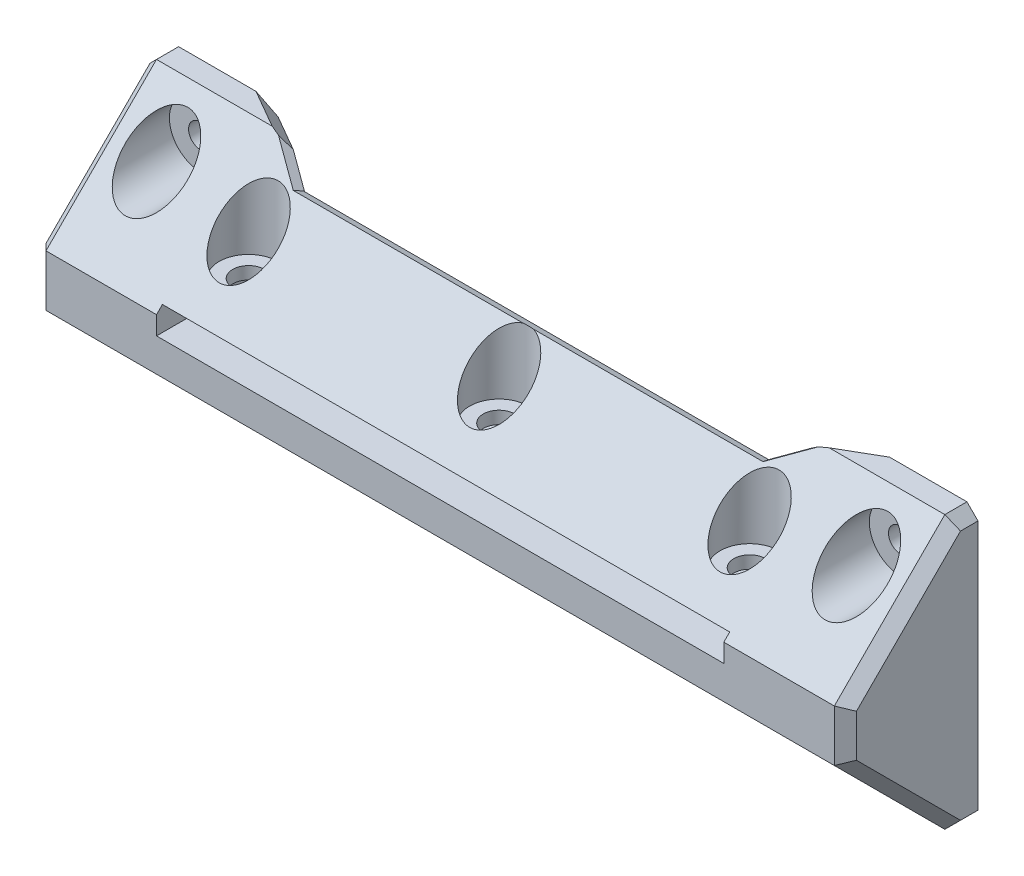
from build123d import *

# Parameters (mm, degrees)
SKETCH1_W          = 110
SKETCH1_H          = 37
SKETCH1_W_2        = 76.99984649
SKETCH1_H_2        = 3.3
EXTRUDE1_DEPTH     = 18
CHAMFER1_SIZE      = 15
SKETCH3_R          = 4.25
CUT_EXTRUDE1_DEPTH = 18
SKETCH4_R          = 2.15
CUT_EXTRUDE2_DEPTH = 19
SKETCH5_R          = 1.75
CUT_EXTRUDE3_DEPTH = 19
SKETCH6_R          = 4
CUT_EXTRUDE4_DEPTH = 41
CUT_EXTRUDE5_DEPTH = 50
CHAMFER2_SIZE      = 1.5
CHAMFER4_SIZE      = 1.5


with BuildPart() as part:
    # Sketch1 → Extrude1 (new body)
    with BuildSketch(Plane.XY):
        with Locations((-47.5, 32.5)):
            Rectangle(SKETCH1_W, SKETCH1_H)
        with Locations((-47.499999999, 35.15)):
            Rectangle(SKETCH1_W_2, SKETCH1_H_2, mode=Mode.SUBTRACT)
        with BuildLine():
            ThreePointArc((-95, 18.35), (-93.35, 20), (-95, 21.65))
            ThreePointArc((-95, 21.65), (-96.65, 20), (-95, 18.35))
        make_face(mode=Mode.SUBTRACT)
        with BuildLine():
            ThreePointArc((0, 18.35), (1.65, 20), (0, 21.65))
            ThreePointArc((0, 21.65), (-1.65, 20), (0, 18.35))
        make_face(mode=Mode.SUBTRACT)
        with BuildLine():
            ThreePointArc((0, 43.35), (1.65, 45), (0, 46.65))
            ThreePointArc((0, 46.65), (-1.65, 45), (0, 43.35))
        make_face(mode=Mode.SUBTRACT)
        with BuildLine():
            ThreePointArc((-95, 43.35), (-93.35, 45), (-95, 46.65))
            ThreePointArc((-95, 46.65), (-96.65, 45), (-95, 43.35))
        make_face(mode=Mode.SUBTRACT)
    extrude(amount=EXTRUDE1_DEPTH)

    # Chamfer1
    # the kernel refuses this chamfer: 15 mm, written as the material it takes off along each edge
    with BuildSketch(Plane(origin=(46.075244819, 14, 18), x_dir=(0, 0.9996219169112968, 0.02749587661058632), z_dir=(-1, 0, 0))) as chamfer1_piece_1:
        Polygon((CHAMFER1_SIZE * 0.999621916911, CHAMFER1_SIZE * 0.0274958766106), (-CHAMFER1_SIZE * 0.0274958766106, CHAMFER1_SIZE * 0.999621916911), (0, 0), align=None)
    extrude(amount=187.150489639, mode=Mode.SUBTRACT)
    with BuildSketch(Plane(origin=(-141.075244819, 51, 18), x_dir=(0, 0.02749587661058632, -0.9996219169112968), z_dir=(1, 0, 0))) as chamfer1_piece_2:
        Polygon((CHAMFER1_SIZE * 0.999621916911, -CHAMFER1_SIZE * 0.0274958766106), (-CHAMFER1_SIZE * 0.0274958766106, -CHAMFER1_SIZE * 0.999621916911), (0, 0), align=None)
    extrude(amount=187.150489639, mode=Mode.SUBTRACT)

    # Sketch3 → Cut-Extrude1 (cut)
    with BuildSketch(Plane(origin=(0, 0, 3), x_dir=(-1, 0, 0), z_dir=(0, 0, -1))):
        with Locations((0, 20)):
            Circle(SKETCH3_R)
        with Locations((95, 20)):
            Circle(SKETCH3_R)
        with Locations((0, 45)):
            Circle(SKETCH3_R)
        with Locations((95, 45)):
            Circle(SKETCH3_R)
    extrude(amount=-CUT_EXTRUDE1_DEPTH, mode=Mode.SUBTRACT)

    # Sketch4 → Cut-Extrude2 (cut)
    with BuildSketch(Plane.XZ.offset(-36.8)):
        with Locations((-13.500076755, 10)):
            Circle(SKETCH4_R)
        with Locations((-81.499923245, 10)):
            Circle(SKETCH4_R)
        with Locations((-47.5, 10)):
            Circle(SKETCH4_R)
    extrude(amount=-CUT_EXTRUDE2_DEPTH, mode=Mode.SUBTRACT)

    # Sketch5 → Cut-Extrude3 (cut)
    with BuildSketch(Plane(origin=(0, 33.5, 0), x_dir=(1, 0, 0), z_dir=(0, 1, 0))):
        with Locations(Location((-81.499923245, -10, 0), (0, 0, 180))):
            Circle(SKETCH5_R)
        with Locations(Location((-47.5, -10, 0), (0, 0, 180))):
            Circle(SKETCH5_R)
        with Locations(Location((-13.500076755, -10, 0), (0, 0, 180))):
            Circle(SKETCH5_R)
    extrude(amount=-CUT_EXTRUDE3_DEPTH, mode=Mode.SUBTRACT)

    # Sketch6 → Cut-Extrude4 (cut)
    with BuildSketch(Plane(origin=(0, 38.5, 0), x_dir=(1, 0, 0), z_dir=(0, 1, 0))):
        with Locations(Location((-81.499923245, -10, 0), (0, 0, 270))):
            Circle(SKETCH6_R)
        with Locations(Location((-47.5, -10, 0), (0, 0, 270))):
            Circle(SKETCH6_R)
        with Locations(Location((-13.500076755, -10, 0), (0, 0, 270))):
            Circle(SKETCH6_R)
    extrude(amount=CUT_EXTRUDE4_DEPTH, mode=Mode.SUBTRACT)

    # Sketch7 → Cut-Extrude5 (cut)
    with BuildSketch(Plane(origin=(0, 51, 0), x_dir=(1, 0, 0), z_dir=(0, 1, 0))):
        Polygon((-87.5, 0), (-78.839745962, -5), (-16.160254038, -5), (-7.5, 0), align=None)
    extrude(amount=-CUT_EXTRUDE5_DEPTH, mode=Mode.SUBTRACT)

    # Chamfer2
    # the kernel refuses this chamfer: 1.5 mm, written as the material it takes off along each edge
    with BuildSketch(Plane(origin=(-78.96313338, 14, 4.928762241), x_dir=(0.013747938305293264, 0.9996219169112968, -0.023812127644090672), z_dir=(-0.8660254037844418, 0, -0.4999999999999946)), Plane(origin=(-4.159285803, 14, -1.928762241), x_dir=(-0.013747938305293165, 0.9996219169112968, -0.023812127644090405), z_dir=(-0.8660254037844415, 0, 0.4999999999999952))) as chamfer2_piece_1:
        Polygon((CHAMFER2_SIZE * 0.999621916911, -CHAMFER2_SIZE * 0.0274958766106), (-CHAMFER2_SIZE * 0.0274958766106, -CHAMFER2_SIZE * 0.999621916911), (0, 0), align=None)
    extrude(amount=13.715048964, mode=Mode.SUBTRACT)
    with BuildSketch(Plane(origin=(-75.882016438, 17.707645937, 6.707645937), x_dir=(-0.3694215037629502, 0.8938706433396608, -0.2540138294130098), z_dir=(-0.7745966692416119, -0.447213595499668, -0.4472135955000256))) as chamfer2_piece_2_section:
        Polygon((CHAMFER2_SIZE * 0.999377760799, -CHAMFER2_SIZE * 0.0352716773028), (CHAMFER2_SIZE * 0.584106684268, -CHAMFER2_SIZE * 0.811676894702), (0, 0), align=None)
    chamfer2_piece_2 = extrude(amount=12.108960747, mode=Mode.PRIVATE)
    chamfer2_piece_2 = split(chamfer2_piece_2, bisect_by=Plane(origin=(-82.667383696, 14.794770385, 5), z_dir=(0, 0, -1)), keep=Keep.TOP, mode=Mode.PRIVATE)
    add(chamfer2_piece_2, mode=Mode.SUBTRACT)
    with BuildSketch(Plane(origin=(-12.350330304, 16, 5), x_dir=(0, 0.9993382493585172, -0.03637393804709672), z_dir=(-1, 0, 0))) as chamfer2_piece_3_section:
        Polygon((CHAMFER2_SIZE * 0.999338249359, -CHAMFER2_SIZE * 0.0363739380471), (CHAMFER2_SIZE * 0.680918594569, -CHAMFER2_SIZE * 0.732359111072), (0, 0), align=None)
    chamfer2_piece_3 = extrude(amount=70.299339393, mode=Mode.PRIVATE)
    chamfer2_piece_3 = split(chamfer2_piece_3, bisect_by=Plane(origin=(-55.185271761, 16.844039672, 18.656917048), z_dir=(0.4999999999999946, 0, -0.8660254037844418)), keep=Keep.TOP, mode=Mode.PRIVATE)
    chamfer2_piece_3 = split(chamfer2_piece_3, bisect_by=Plane(origin=(-39.814728239, 16.844039672, 18.656917048), z_dir=(-0.4999999999999952, 0, -0.8660254037844415)), keep=Keep.TOP, mode=Mode.PRIVATE)
    add(chamfer2_piece_3, mode=Mode.SUBTRACT)
    with BuildSketch(Plane(origin=(-9.738422899, 12.292354063, 1.292354063), x_dir=(0.632061993408797, 0.5224409008540435, 0.5723225852636897), z_dir=(-0.7745966692416112, 0.4472135954996684, 0.447213595500026))) as chamfer2_piece_4_section:
        Polygon((CHAMFER2_SIZE * 0.999377760799, CHAMFER2_SIZE * 0.0352716773028), (CHAMFER2_SIZE * 0.584106684268, CHAMFER2_SIZE * 0.811676894702), (0, 0), align=None)
    chamfer2_piece_4 = extrude(amount=12.108960747, mode=Mode.PRIVATE)
    chamfer2_piece_4 = split(chamfer2_piece_4, bisect_by=Plane(origin=(-12.332616304, 14.794770385, 5), z_dir=(0, 0, -1)), keep=Keep.TOP, mode=Mode.PRIVATE)
    add(chamfer2_piece_4, mode=Mode.SUBTRACT)
    with BuildSketch(Plane(origin=(-90.840714197, 51, -1.928762241), x_dir=(-0.49981095845564294, 0.027495876610586858, 0.8656979742248834), z_dir=(0.8660254037844418, 0, 0.4999999999999946)), Plane(origin=(-16.03686662, 51, 4.928762241), x_dir=(0.4998109584556436, 0.027495876610586837, 0.8656979742248831), z_dir=(0.8660254037844415, 0, -0.4999999999999952))) as chamfer2_piece_5:
        Polygon((CHAMFER2_SIZE * 0.999621916911, CHAMFER2_SIZE * 0.0274958766106), (-CHAMFER2_SIZE * 0.0274958766106, CHAMFER2_SIZE * 0.999621916911), (0, 0), align=None)
    extrude(amount=13.715048964, mode=Mode.SUBTRACT)
    with BuildSketch(Plane(origin=(-75.882016438, 47.292354063, 6.707645937), x_dir=(-0.36942150376344385, -0.8938706433393748, -0.2540138294132983), z_dir=(-0.7745966692413639, 0.44721359550024015, -0.44721359549988254))) as chamfer2_piece_6_section:
        Polygon((CHAMFER2_SIZE * 0.999377760799, CHAMFER2_SIZE * 0.0352716773028), (CHAMFER2_SIZE * 0.584106684268, CHAMFER2_SIZE * 0.811676894702), (0, 0), align=None)
    chamfer2_piece_6 = extrude(amount=12.108960747, mode=Mode.PRIVATE)
    chamfer2_piece_6 = split(chamfer2_piece_6, bisect_by=Plane(origin=(-82.667383696, 50.205229615, 5), z_dir=(0, 0, -1)), keep=Keep.TOP, mode=Mode.PRIVATE)
    add(chamfer2_piece_6, mode=Mode.SUBTRACT)
    with BuildSketch(Plane(origin=(-9.738422899, 52.707645937, 1.292354063), x_dir=(0.6320619934091002, -0.5224409008543227, 0.5723225852631), z_dir=(-0.7745966692413635, -0.4472135955002406, 0.447213595499883))) as chamfer2_piece_7_section:
        Polygon((CHAMFER2_SIZE * 0.999377760799, -CHAMFER2_SIZE * 0.0352716773028), (CHAMFER2_SIZE * 0.584106684268, -CHAMFER2_SIZE * 0.811676894702), (0, 0), align=None)
    chamfer2_piece_7 = extrude(amount=12.108960747, mode=Mode.PRIVATE)
    chamfer2_piece_7 = split(chamfer2_piece_7, bisect_by=Plane(origin=(-12.332616304, 50.205229615, 5), z_dir=(0, 0, -1)), keep=Keep.TOP, mode=Mode.PRIVATE)
    add(chamfer2_piece_7, mode=Mode.SUBTRACT)
    with BuildSketch(Plane(origin=(-12.350330304, 49, 5), x_dir=(0, -0.6809185945692262, 0.7323591110717951), z_dir=(-1, 0, 0))) as chamfer2_piece_8_section:
        Polygon((CHAMFER2_SIZE * 0.999338249359, -CHAMFER2_SIZE * 0.0363739380471), (CHAMFER2_SIZE * 0.680918594569, -CHAMFER2_SIZE * 0.732359111072), (0, 0), align=None)
    chamfer2_piece_8 = extrude(amount=70.299339393, mode=Mode.PRIVATE)
    chamfer2_piece_8 = split(chamfer2_piece_8, bisect_by=Plane(origin=(-55.185271761, 48.155960328, 18.656917048), z_dir=(0.4999999999999946, 0, -0.8660254037844418)), keep=Keep.TOP, mode=Mode.PRIVATE)
    chamfer2_piece_8 = split(chamfer2_piece_8, bisect_by=Plane(origin=(-39.814728239, 48.155960328, 18.656917048), z_dir=(-0.4999999999999952, 0, -0.8660254037844415)), keep=Keep.TOP, mode=Mode.PRIVATE)
    add(chamfer2_piece_8, mode=Mode.SUBTRACT)
    with BuildSketch(Plane(origin=(-75.882016438, 17.707645937, 6.707645937), x_dir=(-0.3694215037629502, 0.8938706433396608, -0.2540138294130098), z_dir=(-0.7745966692416119, -0.447213595499668, -0.4472135955000256))) as chamfer2_piece_9a_section:
        Polygon((CHAMFER2_SIZE * 0.999377760799, -CHAMFER2_SIZE * 0.0352716773028), (CHAMFER2_SIZE * 0.584106684268, -CHAMFER2_SIZE * 0.811676894702), (0, 0), align=None)
    chamfer2_piece_9a = extrude(amount=12.108960747, mode=Mode.PRIVATE)
    chamfer2_piece_9a = split(chamfer2_piece_9a, bisect_by=Plane(origin=(-78.056519798, 17.459729148, 5), z_dir=(0, 0, 1)), keep=Keep.TOP, mode=Mode.PRIVATE)
    with BuildSketch(Plane(origin=(-12.350330304, 16, 5), x_dir=(0, 0.9993382493585172, -0.03637393804709672), z_dir=(-1, 0, 0))) as chamfer2_piece_9b_section:
        Polygon((CHAMFER2_SIZE * 0.999338249359, -CHAMFER2_SIZE * 0.0363739380471), (CHAMFER2_SIZE * 0.680918594569, -CHAMFER2_SIZE * 0.732359111072), (0, 0), align=None)
    chamfer2_piece_9b = extrude(amount=70.299339393, mode=Mode.PRIVATE)
    chamfer2_piece_9b = split(chamfer2_piece_9b, bisect_by=Plane(origin=(-79.856881758, 16.851083443, 4.412756374), z_dir=(-0.4999999999999946, 0, 0.8660254037844418)), keep=Keep.TOP, mode=Mode.PRIVATE)
    chamfer2_piece_9 = chamfer2_piece_9a & chamfer2_piece_9b
    add(chamfer2_piece_9, mode=Mode.SUBTRACT)
    with BuildSketch(Plane(origin=(-12.350330304, 16, 5), x_dir=(0, 0.9993382493585172, -0.03637393804709672), z_dir=(-1, 0, 0))) as chamfer2_piece_10a_section:
        Polygon((CHAMFER2_SIZE * 0.999338249359, -CHAMFER2_SIZE * 0.0363739380471), (CHAMFER2_SIZE * 0.680918594569, -CHAMFER2_SIZE * 0.732359111072), (0, 0), align=None)
    chamfer2_piece_10a = extrude(amount=70.299339393, mode=Mode.PRIVATE)
    chamfer2_piece_10a = split(chamfer2_piece_10a, bisect_by=Plane(origin=(-15.143118242, 16.851083443, 4.412756374), z_dir=(0.4999999999999952, 0, 0.8660254037844415)), keep=Keep.TOP, mode=Mode.PRIVATE)
    with BuildSketch(Plane(origin=(-9.738422899, 12.292354063, 1.292354063), x_dir=(0.632061993408797, 0.5224409008540435, 0.5723225852636897), z_dir=(-0.7745966692416112, 0.4472135954996684, 0.447213595500026))) as chamfer2_piece_10b_section:
        Polygon((CHAMFER2_SIZE * 0.999377760799, CHAMFER2_SIZE * 0.0352716773028), (CHAMFER2_SIZE * 0.584106684268, CHAMFER2_SIZE * 0.811676894702), (0, 0), align=None)
    chamfer2_piece_10b = extrude(amount=12.108960747, mode=Mode.PRIVATE)
    chamfer2_piece_10b = split(chamfer2_piece_10b, bisect_by=Plane(origin=(-16.943480202, 17.459729148, 5), z_dir=(0, 0, 1)), keep=Keep.TOP, mode=Mode.PRIVATE)
    chamfer2_piece_10 = chamfer2_piece_10a & chamfer2_piece_10b
    add(chamfer2_piece_10, mode=Mode.SUBTRACT)
    with BuildSketch(Plane(origin=(-75.882016438, 47.292354063, 6.707645937), x_dir=(-0.36942150376344385, -0.8938706433393748, -0.2540138294132983), z_dir=(-0.7745966692413639, 0.44721359550024015, -0.44721359549988254))) as chamfer2_piece_11a_section:
        Polygon((CHAMFER2_SIZE * 0.999377760799, CHAMFER2_SIZE * 0.0352716773028), (CHAMFER2_SIZE * 0.584106684268, CHAMFER2_SIZE * 0.811676894702), (0, 0), align=None)
    chamfer2_piece_11a = extrude(amount=12.108960747, mode=Mode.PRIVATE)
    chamfer2_piece_11a = split(chamfer2_piece_11a, bisect_by=Plane(origin=(-78.056519798, 47.540270852, 5), z_dir=(0, 0, 1)), keep=Keep.TOP, mode=Mode.PRIVATE)
    with BuildSketch(Plane(origin=(-12.350330304, 49, 5), x_dir=(0, -0.6809185945692262, 0.7323591110717951), z_dir=(-1, 0, 0))) as chamfer2_piece_11b_section:
        Polygon((CHAMFER2_SIZE * 0.999338249359, -CHAMFER2_SIZE * 0.0363739380471), (CHAMFER2_SIZE * 0.680918594569, -CHAMFER2_SIZE * 0.732359111072), (0, 0), align=None)
    chamfer2_piece_11b = extrude(amount=70.299339393, mode=Mode.PRIVATE)
    chamfer2_piece_11b = split(chamfer2_piece_11b, bisect_by=Plane(origin=(-79.856881758, 48.148916557, 4.412756374), z_dir=(-0.4999999999999946, 0, 0.8660254037844418)), keep=Keep.TOP, mode=Mode.PRIVATE)
    chamfer2_piece_11 = chamfer2_piece_11a & chamfer2_piece_11b
    add(chamfer2_piece_11, mode=Mode.SUBTRACT)
    with BuildSketch(Plane(origin=(-9.738422899, 52.707645937, 1.292354063), x_dir=(0.6320619934091002, -0.5224409008543227, 0.5723225852631), z_dir=(-0.7745966692413635, -0.4472135955002406, 0.447213595499883))) as chamfer2_piece_12a_section:
        Polygon((CHAMFER2_SIZE * 0.999377760799, -CHAMFER2_SIZE * 0.0352716773028), (CHAMFER2_SIZE * 0.584106684268, -CHAMFER2_SIZE * 0.811676894702), (0, 0), align=None)
    chamfer2_piece_12a = extrude(amount=12.108960747, mode=Mode.PRIVATE)
    chamfer2_piece_12a = split(chamfer2_piece_12a, bisect_by=Plane(origin=(-16.943480202, 47.540270852, 5), z_dir=(0, 0, 1)), keep=Keep.TOP, mode=Mode.PRIVATE)
    with BuildSketch(Plane(origin=(-12.350330304, 49, 5), x_dir=(0, -0.6809185945692262, 0.7323591110717951), z_dir=(-1, 0, 0))) as chamfer2_piece_12b_section:
        Polygon((CHAMFER2_SIZE * 0.999338249359, -CHAMFER2_SIZE * 0.0363739380471), (CHAMFER2_SIZE * 0.680918594569, -CHAMFER2_SIZE * 0.732359111072), (0, 0), align=None)
    chamfer2_piece_12b = extrude(amount=70.299339393, mode=Mode.PRIVATE)
    chamfer2_piece_12b = split(chamfer2_piece_12b, bisect_by=Plane(origin=(-15.143118242, 48.148916557, 4.412756374), z_dir=(0.4999999999999952, 0, 0.8660254037844415)), keep=Keep.TOP, mode=Mode.PRIVATE)
    chamfer2_piece_12 = chamfer2_piece_12a & chamfer2_piece_12b
    add(chamfer2_piece_12, mode=Mode.SUBTRACT)

    # Chamfer4
    chamfer4_edges = [part.edges().sort_by_distance(p)[0] for p in [
        (-102.5, 32.5, 18),
        (7.5, 32.5, 18),
        (7.5, 51, 1.5),
        (7.5, 14, 1.5),
        (7.5, 43.5, 10.5),
        (7.5, 21.5, 10.5),
        (-102.5, 14, 1.5),
        (-102.5, 51, 1.5),
        (-102.5, 43.5, 10.5),
        (-102.5, 21.5, 10.5),
    ]]
    chamfer(chamfer4_edges, length=CHAMFER4_SIZE)


solid = part.part
